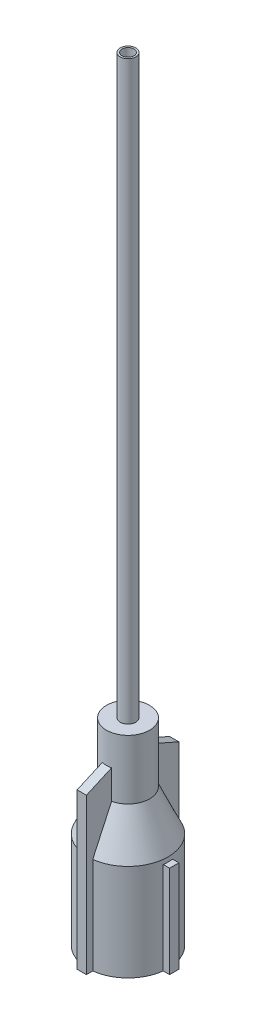
from build123d import *

# Parameters (mm, degrees)
SKETCH1_R           = 2.7432
BOSS_EXTRUDE1_DEPTH = 17.78
SKETCH2_R           = 3.175
SKETCH2_R_2         = 1.4732
CUT_EXTRUDE1_DEPTH  = 4.064
SKETCH4_R           = 3.175
BOSS_EXTRUDE2_DEPTH = 2.9972
SKETCH5_W           = 0.635
SKETCH5_H           = 6.318170226
BOSS_EXTRUDE3_DEPTH = 12.7
SKETCH6_W           = 6.318170226
SKETCH6_H           = 0.635
BOSS_EXTRUDE4_DEPTH = 7.62
CUT_EXTRUDE2_DEPTH  = 7.62
SKETCH8_R           = 2.1209
CUT_EXTRUDE3_DEPTH  = 10.922
CUT_EXTRUDE4_START  = -6.858
SKETCH9_R           = 0.508
CUT_EXTRUDE4_DEPTH  = 6.858
SWEEP2_PITCH        = 2.54
SWEEP2_HEIGHT       = 1.143
SWEEP2_RADIUS       = 3.175
SWEEP2_START_ANGLE  = -90
SKETCH10_W          = 0.508
SKETCH10_H          = 0.762
SWEEP3_PITCH        = 2.54
SWEEP3_HEIGHT       = 1.143
SWEEP3_RADIUS       = 3.175
SWEEP3_START_ANGLE  = 90
SKETCH17_W          = 0.508
SKETCH17_H          = 0.762
SKETCH18_R          = 0.5334
SKETCH18_R_2        = 0.4064
BOSS_EXTRUDE6_DEPTH = 46.228
INTERSECT1_DEPTH    = 4.318


# Read off the part's stored shape, not the designer's step: Intersect1
with BuildPart() as part:
    # Sketch1 → Boss-Extrude1 (new body)
    with BuildSketch(Plane(origin=(0, 0, 0), x_dir=(1, 0, 0), z_dir=(0, 1, 0))):
        with Locations(Location((0, 0, 0), (0, 0, 270))):
            Circle(SKETCH1_R)
    extrude(amount=BOSS_EXTRUDE1_DEPTH)

    # Sketch2 → Cut-Extrude1 (cut)
    with BuildSketch(Plane(origin=(0, 17.78, 0), x_dir=(1, 0, 0), z_dir=(0, 1, 0))):
        Circle(SKETCH2_R)
        with Locations(Location((0, 0, 0), (0, 0, 270))):
            Circle(SKETCH2_R_2, mode=Mode.SUBTRACT)
    extrude(amount=-CUT_EXTRUDE1_DEPTH, mode=Mode.SUBTRACT)

    # Sketch3 → Cut-Revolve1 (revolve, cut)
    with BuildSketch(Plane.XY, mode=Mode.PRIVATE) as cut_revolve1_sk:
        Polygon((1.4732, 13.716), (2.7432, 10.922), (2.7432, 13.716), align=None)
    revolve(cut_revolve1_sk.sketch.rotate(Axis((0, 13.716, 0), (0, 1, 0)), 90), axis=Axis((0, 13.716, 0), (0, 1, 0)), mode=Mode.SUBTRACT)

    # Sketch4 → Boss-Extrude2 (add)
    with BuildSketch(Plane.XZ):
        with Locations(Location((0, 0, 0), (0, 0, 270))):
            Circle(SKETCH4_R)
    extrude(amount=-BOSS_EXTRUDE2_DEPTH)

    # Sketch5 → Boss-Extrude3 (add)
    with BuildSketch(Plane(origin=(0, 2.9972, 0), x_dir=(1, 0, 0), z_dir=(0, 1, 0))):
        Rectangle(SKETCH5_W, SKETCH5_H)
    extrude(amount=BOSS_EXTRUDE3_DEPTH)

    # Sketch6 → Boss-Extrude4 (add)
    with BuildSketch(Plane(origin=(0, 2.9972, 0), x_dir=(1, 0, 0), z_dir=(0, 1, 0))):
        Rectangle(SKETCH6_W, SKETCH6_H)
    extrude(amount=BOSS_EXTRUDE4_DEPTH)

    # Sketch7 → Cut-Extrude2 (cut)
    with BuildSketch(Plane(origin=(0.3175, 0, 0), x_dir=(0, 0, -1), z_dir=(1, 0, 0))):
        Polygon((1.438579852, 15.6972), (3.159085113, 14.9352), (3.159085113, 15.6972), align=None)
        Polygon((-1.438579852, 15.6972), (-3.159085113, 15.6972), (-3.159085113, 14.9352), align=None)
    extrude(amount=-CUT_EXTRUDE2_DEPTH, mode=Mode.SUBTRACT)

    # Sketch8 → Cut-Extrude3 (cut)
    with BuildSketch(Plane.XZ):
        with Locations(Location((0, 0, 0), (0, 0, 270))):
            Circle(SKETCH8_R)
    extrude(amount=-CUT_EXTRUDE3_DEPTH, mode=Mode.SUBTRACT)

    # Sketch9 → Cut-Extrude4 (cut)
    with BuildSketch(Plane(origin=(0, 17.78, 0), x_dir=(1, 0, 0), z_dir=(0, 1, 0)).offset(CUT_EXTRUDE4_START)):
        with Locations(Location((0, 0, 0), (0, 0, 270))):
            Circle(SKETCH9_R)
    extrude(amount=CUT_EXTRUDE4_DEPTH, mode=Mode.SUBTRACT)

    # Sweep2: sweep along a helix
    with BuildLine() as sweep2_path:
        add(Helix(SWEEP2_PITCH, SWEEP2_HEIGHT, SWEEP2_RADIUS, center=(0, 0.508, 0), direction=(0, 1, 0), mode=Mode.PRIVATE).rotate(Axis((0, 0.508, 0), (0, 1, 0)), SWEEP2_START_ANGLE))
    # Sketch10 → Sweep2 (sweep)
    with BuildSketch(Plane.XY):
        with Locations((-3.429, 0.889)):
            Rectangle(SKETCH10_W, SKETCH10_H)
    sweep(path=sweep2_path.line, is_frenet=True)

    # Sweep3: sweep along a helix
    with BuildLine() as sweep3_path:
        add(Helix(SWEEP3_PITCH, SWEEP3_HEIGHT, SWEEP3_RADIUS, center=(0, 0.508, 0), direction=(0, 1, 0), mode=Mode.PRIVATE).rotate(Axis((0, 0.508, 0), (0, 1, 0)), SWEEP3_START_ANGLE))
    # Sketch17 → Sweep3 (sweep)
    with BuildSketch(Plane.XY):
        with Locations((3.429, 0.889)):
            Rectangle(SKETCH17_W, SKETCH17_H)
    sweep(path=sweep3_path.line, is_frenet=True)

    # Sketch18 → Boss-Extrude6 (add)
    with BuildSketch(Plane.XZ.offset(-10.922)):
        with Locations(Location((0, 0, 0), (0, 0, 90))):
            Circle(SKETCH18_R)
        with Locations(Location((0, 0, 0), (0, 0, 270))):
            Circle(SKETCH18_R_2, mode=Mode.SUBTRACT)
    extrude(amount=-BOSS_EXTRUDE6_DEPTH)

    # Intersect1 outline → Intersect1 (cut)
    with BuildSketch(Plane(origin=(0, 0, 0), x_dir=(1, 0, 0), z_dir=(0, 1, 0))):
        with BuildLine():
            Line((-3.175, 0), (-3.683, 0))
            add(Edge.make_bspline(
                [(-3.683, 0), (-3.683, -1.196679241), (-2.97960959, -2.164813084), (-2.276219181, -3.132946927), (-1.13810959, -3.50274115), (0, -3.872535372), (1.13810959, -3.50274115), (2.276219181, -3.132946927), (2.97960959, -2.164813084), (3.322482299, -1.692889287), (3.50274115, -1.13810959)],
                knots=[0, 0, 0, 0.1, 0.1, 0.2, 0.2, 0.3, 0.3, 0.4, 0.4, 0.45, 0.45, 0.45], degree=2, weights=[1, 0.951056516, 1, 0.951056516, 1, 0.951056516, 1, 0.951056516, 1, 0.975528258, 0.975528258]))
            Line((3.50274115, -1.13810959), (3.019604439, -0.981128957))
            ThreePointArc((3.019604439, -0.981128957), (1.992470769, -2.471980023), (0.3175, -3.159085113))
            ThreePointArc((0.3175, -3.159085113), (0, -3.175), (-0.3175, -3.159085113))
            ThreePointArc((-0.3175, -3.159085113), (-2.24506403, -2.24506403), (-3.159085113, -0.3175))
            ThreePointArc((-3.159085113, -0.3175), (-3.171018782, -0.158949311), (-3.175, 0))
        make_face()
        with BuildLine():
            ThreePointArc((-3.159085113, 0.3175), (-3.171018782, 0.158949311), (-3.175, 0))
            ThreePointArc((-3.175, 0), (-3.171018782, -0.158949311), (-3.159085113, -0.3175))
            Line((-3.159085113, -0.3175), (-3.159085113, 0.3175))
        make_face()
        with BuildLine():
            ThreePointArc((0.3175, -3.159085113), (1.992470769, -2.471980023), (3.019604439, -0.981128957))
            ThreePointArc((3.019604439, -0.981128957), (3.107113129, -0.653049008), (3.159085113, -0.3175))
            Line((3.159085113, -0.3175), (2.724764208, -0.3175))
            ThreePointArc((2.724764208, -0.3175), (1.939735322, -1.939735322), (0.3175, -2.724764208))
            Line((0.3175, -2.724764208), (0.3175, -3.159085113))
        make_face()
        with BuildLine():
            ThreePointArc((-3.019604439, 0.981128957), (-3.107113129, 0.653049008), (-3.159085113, 0.3175))
            Line((-3.159085113, 0.3175), (-2.724764208, 0.3175))
            ThreePointArc((-2.724764208, 0.3175), (-1.939735322, 1.939735322), (-0.3175, 2.724764208))
            Line((-0.3175, 2.724764208), (-0.3175, 3.159085113))
            ThreePointArc((-0.3175, 3.159085113), (-1.992470769, 2.471980023), (-3.019604439, 0.981128957))
        make_face()
        with BuildLine():
            Line((-2.724764208, 0.3175), (-3.159085113, 0.3175))
            Line((-3.159085113, 0.3175), (-3.159085113, -0.3175))
            Line((-3.159085113, -0.3175), (-2.724764208, -0.3175))
            ThreePointArc((-2.724764208, -0.3175), (-2.7432, 0), (-2.724764208, 0.3175))
        make_face()
        with BuildLine():
            Line((-2.724764208, -0.3175), (-3.159085113, -0.3175))
            ThreePointArc((-3.159085113, -0.3175), (-2.24506403, -2.24506403), (-0.3175, -3.159085113))
            Line((-0.3175, -3.159085113), (-0.3175, -2.724764208))
            ThreePointArc((-0.3175, -2.724764208), (-1.939735322, -1.939735322), (-2.724764208, -0.3175))
        make_face()
        with BuildLine():
            Line((-0.3175, -3.159085113), (0.3175, -3.159085113))
            Line((0.3175, -3.159085113), (0.3175, -2.724764208))
            Line((0.3175, -2.724764208), (0.3175, -2.097000372))
            ThreePointArc((0.3175, -2.097000372), (0, -2.1209), (-0.3175, -2.097000372))
            Line((-0.3175, -2.097000372), (-0.3175, -2.724764208))
            Line((-0.3175, -2.724764208), (-0.3175, -3.159085113))
        make_face()
        with BuildLine():
            ThreePointArc((-0.3175, -3.159085113), (0, -3.175), (0.3175, -3.159085113))
            Line((0.3175, -3.159085113), (-0.3175, -3.159085113))
        make_face()
        with BuildLine():
            Line((3.159085113, 0.3175), (3.159085113, -0.3175))
            ThreePointArc((3.159085113, -0.3175), (3.171018782, -0.158949311), (3.175, 0))
            ThreePointArc((3.175, 0), (3.171018782, 0.158949311), (3.159085113, 0.3175))
        make_face()
        with BuildLine():
            Line((2.724764208, -0.3175), (3.159085113, -0.3175))
            Line((3.159085113, -0.3175), (3.159085113, 0.3175))
            Line((3.159085113, 0.3175), (2.724764208, 0.3175))
            ThreePointArc((2.724764208, 0.3175), (2.7432, 0), (2.724764208, -0.3175))
        make_face()
        with BuildLine():
            Line((-3.50274115, 1.13810959), (-3.019604439, 0.981128957))
            ThreePointArc((-3.019604439, 0.981128957), (-1.992470769, 2.471980023), (-0.3175, 3.159085113))
            ThreePointArc((-0.3175, 3.159085113), (0, 3.175), (0.3175, 3.159085113))
            ThreePointArc((0.3175, 3.159085113), (2.24506403, 2.24506403), (3.159085113, 0.3175))
            ThreePointArc((3.159085113, 0.3175), (3.171018782, 0.158949311), (3.175, 0))
            Line((3.175, 0), (3.683, 0))
            add(Edge.make_bspline(
                [(3.683, 0), (3.683, 1.196679241), (2.97960959, 2.164813084), (2.276219181, 3.132946927), (1.13810959, 3.50274115), (0, 3.872535372), (-1.13810959, 3.50274115), (-2.276219181, 3.132946927), (-2.97960959, 2.164813084), (-3.322482299, 1.692889287), (-3.50274115, 1.13810959)],
                knots=[0, 0, 0, 0.1, 0.1, 0.2, 0.2, 0.3, 0.3, 0.4, 0.4, 0.45, 0.45, 0.45], degree=2, weights=[1, 0.951056516, 1, 0.951056516, 1, 0.951056516, 1, 0.951056516, 1, 0.975528258, 0.975528258]))
        make_face()
        with BuildLine():
            ThreePointArc((-0.3175, 2.724764208), (-1.939735322, 1.939735322), (-2.724764208, 0.3175))
            ThreePointArc((-2.724764208, 0.3175), (-2.7432, 0), (-2.724764208, -0.3175))
            ThreePointArc((-2.724764208, -0.3175), (-1.939735322, -1.939735322), (-0.3175, -2.724764208))
            Line((-0.3175, -2.724764208), (-0.3175, -2.097000372))
            ThreePointArc((-0.3175, -2.097000372), (-2.1209, 0), (-0.3175, 2.097000372))
            Line((-0.3175, 2.097000372), (-0.3175, 2.724764208))
        make_face()
        with BuildLine():
            Line((0.3175, -2.097000372), (0.3175, -2.724764208))
            ThreePointArc((0.3175, -2.724764208), (1.939735322, -1.939735322), (2.724764208, -0.3175))
            ThreePointArc((2.724764208, -0.3175), (2.7432, 0), (2.724764208, 0.3175))
            ThreePointArc((2.724764208, 0.3175), (1.939735322, 1.939735322), (0.3175, 2.724764208))
            Line((0.3175, 2.724764208), (0.3175, 2.097000372))
            ThreePointArc((0.3175, 2.097000372), (1.608042686, 1.382901128), (2.1209, 0))
            ThreePointArc((2.1209, 0), (1.608042686, -1.382901128), (0.3175, -2.097000372))
        make_face()
        with BuildLine():
            Line((2.724764208, 0.3175), (3.159085113, 0.3175))
            ThreePointArc((3.159085113, 0.3175), (2.24506403, 2.24506403), (0.3175, 3.159085113))
            Line((0.3175, 3.159085113), (0.3175, 2.724764208))
            ThreePointArc((0.3175, 2.724764208), (1.939735322, 1.939735322), (2.724764208, 0.3175))
        make_face()
        with BuildLine():
            ThreePointArc((0.3175, 3.159085113), (0, 3.175), (-0.3175, 3.159085113))
            Line((-0.3175, 3.159085113), (0.3175, 3.159085113))
        make_face()
        with BuildLine():
            Line((0.3175, 3.159085113), (-0.3175, 3.159085113))
            Line((-0.3175, 3.159085113), (-0.3175, 2.724764208))
            Line((-0.3175, 2.724764208), (-0.3175, 2.097000372))
            ThreePointArc((-0.3175, 2.097000372), (0, 2.1209), (0.3175, 2.097000372))
            Line((0.3175, 2.097000372), (0.3175, 2.724764208))
            Line((0.3175, 2.724764208), (0.3175, 3.159085113))
        make_face()
    extrude(amount=INTERSECT1_DEPTH, mode=Mode.SUBTRACT)


solid = part.part
